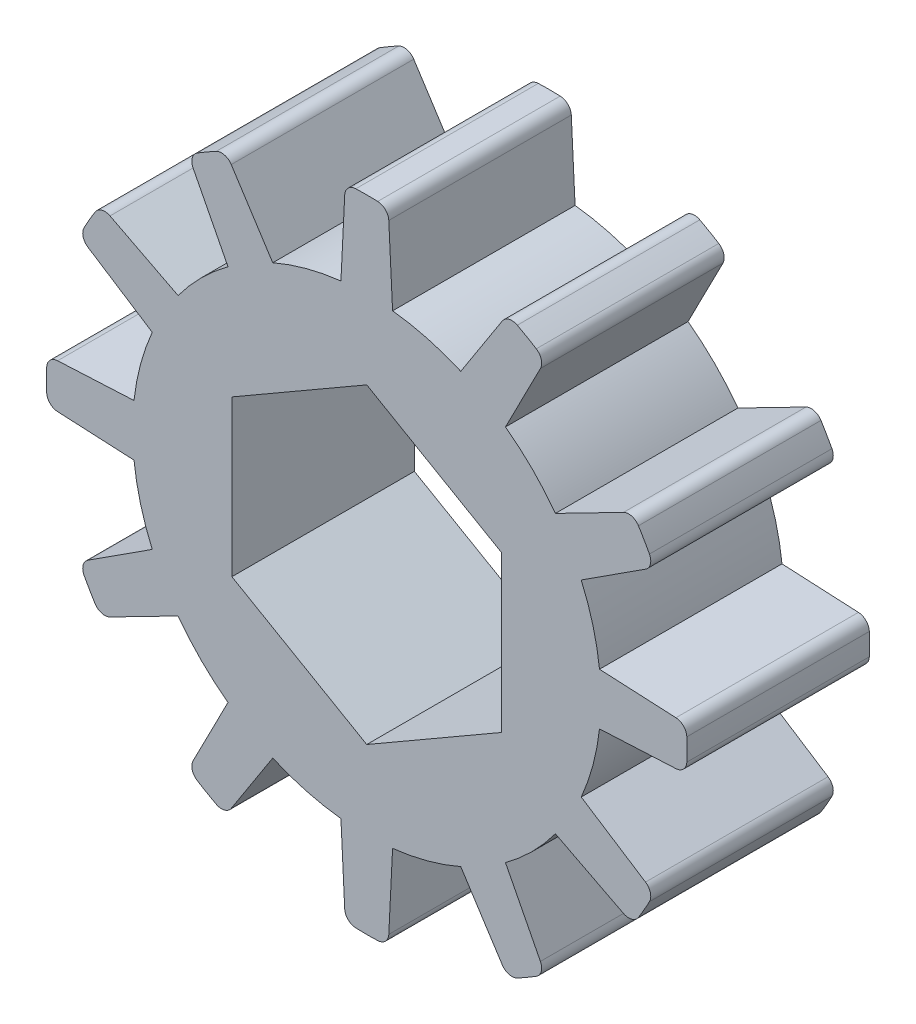
from build123d import *

# Parameters (mm, degrees)
CROQUIS1_R              = 0.5
SALIENTE_EXTRUIR1_DEPTH = 3.18
CORTAR_EXTRUIR3_DEPTH   = 9.508591314
REDONDEO1_R             = 0.2


with BuildPart() as part:
    # Croquis1 → Saliente-Extruir1 (new body)
    with BuildSketch(Plane.XY):
        with BuildLine():
            Line((0.375, 5.567875544), (0.45, 4.055600396))
            ThreePointArc((0.45, 4.055600396), (1.056108396, 3.941450193), (1.638088766, 3.737252971))
            Line((1.638088766, 3.737252971), (2.459178246, 5.009421667))
            ThreePointArc((2.459178246, 5.009421667), (2.790244751, 4.832845674), (3.108697299, 4.634421667))
            Line((3.108697299, 4.634421667), (2.41751163, 3.287252971))
            ThreePointArc((2.41751163, 3.287252971), (2.885341797, 2.885341797), (3.287252971, 2.41751163))
            Line((3.287252971, 2.41751163), (4.634421667, 3.108697299))
            ThreePointArc((4.634421667, 3.108697299), (4.832845674, 2.790244751), (5.009421667, 2.459178246))
            Line((5.009421667, 2.459178246), (3.737252971, 1.638088766))
            ThreePointArc((3.737252971, 1.638088766), (3.941450193, 1.056108396), (4.055600396, 0.45))
            Line((4.055600396, 0.45), (5.567875544, 0.375))
            ThreePointArc((5.567875544, 0.375), (5.580489502, 0), (5.567875544, -0.375))
            Line((5.567875544, -0.375), (4.055600396, -0.45))
            ThreePointArc((4.055600396, -0.45), (3.941450193, -1.056108396), (3.737252971, -1.638088766))
            Line((3.737252971, -1.638088766), (5.009421667, -2.459178246))
            ThreePointArc((5.009421667, -2.459178246), (4.832845674, -2.790244751), (4.634421667, -3.108697299))
            Line((4.634421667, -3.108697299), (3.287252971, -2.41751163))
            ThreePointArc((3.287252971, -2.41751163), (2.885341797, -2.885341797), (2.41751163, -3.287252971))
            Line((2.41751163, -3.287252971), (3.108697299, -4.634421667))
            ThreePointArc((3.108697299, -4.634421667), (2.790244751, -4.832845674), (2.459178246, -5.009421667))
            Line((2.459178246, -5.009421667), (1.638088766, -3.737252971))
            ThreePointArc((1.638088766, -3.737252971), (1.056108396, -3.941450193), (0.45, -4.055600396))
            Line((0.45, -4.055600396), (0.375, -5.567875544))
            ThreePointArc((0.375, -5.567875544), (0, -5.580489502), (-0.375, -5.567875544))
            Line((-0.375, -5.567875544), (-0.45, -4.055600396))
            ThreePointArc((-0.45, -4.055600396), (-1.056108396, -3.941450193), (-1.638088766, -3.737252971))
            Line((-1.638088766, -3.737252971), (-2.459178246, -5.009421667))
            ThreePointArc((-2.459178246, -5.009421667), (-2.790244751, -4.832845674), (-3.108697299, -4.634421667))
            Line((-3.108697299, -4.634421667), (-2.41751163, -3.287252971))
            ThreePointArc((-2.41751163, -3.287252971), (-2.885341797, -2.885341797), (-3.287252971, -2.41751163))
            Line((-3.287252971, -2.41751163), (-4.634421667, -3.108697299))
            ThreePointArc((-4.634421667, -3.108697299), (-4.832845674, -2.790244751), (-5.009421667, -2.459178246))
            Line((-5.009421667, -2.459178246), (-3.737252971, -1.638088766))
            ThreePointArc((-3.737252971, -1.638088766), (-3.941450193, -1.056108396), (-4.055600396, -0.45))
            Line((-4.055600396, -0.45), (-5.567875544, -0.375))
            ThreePointArc((-5.567875544, -0.375), (-5.580489502, 0), (-5.567875544, 0.375))
            Line((-5.567875544, 0.375), (-4.055600396, 0.45))
            ThreePointArc((-4.055600396, 0.45), (-3.941450193, 1.056108396), (-3.737252971, 1.638088766))
            Line((-3.737252971, 1.638088766), (-5.009421667, 2.459178246))
            ThreePointArc((-5.009421667, 2.459178246), (-4.832845674, 2.790244751), (-4.634421667, 3.108697299))
            Line((-4.634421667, 3.108697299), (-3.287252971, 2.41751163))
            ThreePointArc((-3.287252971, 2.41751163), (-2.885341797, 2.885341797), (-2.41751163, 3.287252971))
            Line((-2.41751163, 3.287252971), (-3.108697299, 4.634421667))
            ThreePointArc((-3.108697299, 4.634421667), (-2.790244751, 4.832845674), (-2.459178246, 5.009421667))
            Line((-2.459178246, 5.009421667), (-1.638088766, 3.737252971))
            ThreePointArc((-1.638088766, 3.737252971), (-1.056108396, 3.941450193), (-0.45, 4.055600396))
            Line((-0.45, 4.055600396), (-0.375, 5.567875544))
            ThreePointArc((-0.375, 5.567875544), (0, 5.580489502), (0.375, 5.567875544))
        make_face()
        Circle(CROQUIS1_R, mode=Mode.SUBTRACT)
    extrude(amount=SALIENTE_EXTRUIR1_DEPTH)

    # Croquis10 → Cortar-Extruir3 (cut, through all)
    with BuildSketch(Plane(origin=(0, 0, 0), x_dir=(-1, 0, 0), z_dir=(0, 0, -1))):
        Polygon((0, -2.713546265), (2.35, -1.356773133), (2.35, 1.356773133), (0, 2.713546265), (-2.35, 1.356773133), (-2.35, -1.356773133), align=None)
    extrude(amount=-CORTAR_EXTRUIR3_DEPTH, mode=Mode.SUBTRACT)

    # Redondeo1
    redondeo1_edges = [part.edges().sort_by_distance(p)[0] for p in [
        (5.567875544, -0.375, 1.59),
        (-2.459178246, -5.009421667, 1.59),
        (-3.108697299, -4.634421667, 1.59),
        (0.375, -5.567875544, 1.59),
        (-0.375, -5.567875544, 1.59),
        (3.108697299, -4.634421667, 1.59),
        (2.459178246, -5.009421667, 1.59),
        (5.009421667, -2.459178246, 1.59),
        (4.634421667, -3.108697299, 1.59),
        (-4.634421667, -3.108697299, 1.59),
        (-5.009421667, -2.459178246, 1.59),
        (-5.567875544, -0.375, 1.59),
        (-5.567875544, 0.375, 1.59),
        (-5.009421667, 2.459178246, 1.59),
        (-4.634421667, 3.108697299, 1.59),
        (-3.108697299, 4.634421667, 1.59),
        (-2.459178246, 5.009421667, 1.59),
        (5.567875544, 0.375, 1.59),
        (5.009421667, 2.459178246, 1.59),
        (4.634421667, 3.108697299, 1.59),
        (3.108697299, 4.634421667, 1.59),
        (2.459178246, 5.009421667, 1.59),
        (0.375, 5.567875544, 1.59),
        (-0.375, 5.567875544, 1.59),
    ]]
    fillet(redondeo1_edges, radius=REDONDEO1_R)


solid = part.part
